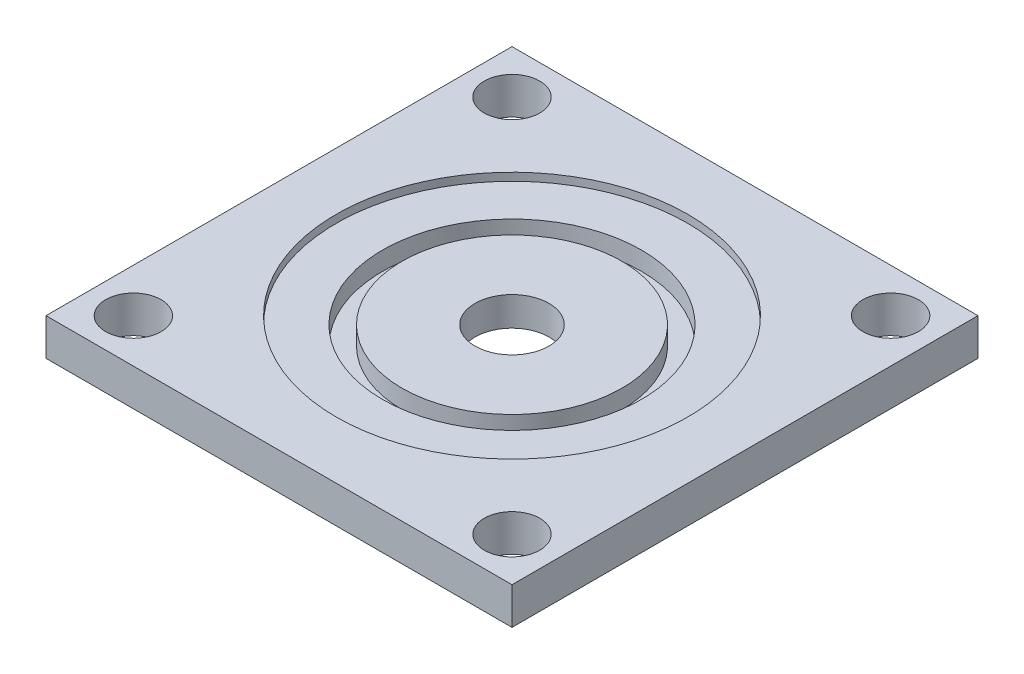
from build123d import *

# Parameters (mm, degrees)
PLATEOUTLINE_W      = 80
PLATEOUTLINE_H      = 80
BOSS_EXTRUDE1_DEPTH = 6.35
RAILGUIDES_R        = 4.7625
CUT_EXTRUDE1_DEPTH  = 10
CUT_EXTRUDE2_START  = 5
FUELGRAINMOUNTING_R = 30.1625
CUT_EXTRUDE2_DEPTH  = 5
GASINTAKE_R         = 6.35
CUT_EXTRUDE3_DEPTH  = 5
CUT_EXTRUDE4_START  = 5
SKETCH1_R           = 22.225
SKETCH1_R_2         = 18.878675
CUT_EXTRUDE4_DEPTH  = 3.175


with BuildPart() as part:
    # plateOutline → Boss-Extrude1 (new body)
    with BuildSketch(Plane(origin=(0, 0, 0), x_dir=(1, 0, 0), z_dir=(0, 1, 0))):
        Rectangle(PLATEOUTLINE_W, PLATEOUTLINE_H)
    extrude(amount=BOSS_EXTRUDE1_DEPTH)

    # railGuides → Cut-Extrude1 (cut)
    with BuildSketch(Plane(origin=(0, 0, 0), x_dir=(1, 0, 0), z_dir=(0, 1, 0))):
        with Locations((-32.5, 32.5)):
            Circle(RAILGUIDES_R)
        with Locations((32.5, 32.5)):
            Circle(RAILGUIDES_R)
        with Locations((32.5, -32.5)):
            Circle(RAILGUIDES_R)
        with Locations((-32.5, -32.5)):
            Circle(RAILGUIDES_R)
    extrude(amount=CUT_EXTRUDE1_DEPTH, mode=Mode.SUBTRACT)

    # FuelGrainMounting → Cut-Extrude2 (cut)
    with BuildSketch(Plane(origin=(0, 0, 0), x_dir=(1, 0, 0), z_dir=(0, 1, 0)).offset(CUT_EXTRUDE2_START)):
        Circle(FUELGRAINMOUNTING_R)
    extrude(amount=CUT_EXTRUDE2_DEPTH, mode=Mode.SUBTRACT)

    # GasIntake → Cut-Extrude3 (cut)
    with BuildSketch(Plane(origin=(0, 0, 0), x_dir=(1, 0, 0), z_dir=(0, 1, 0))):
        Circle(GASINTAKE_R)
    extrude(amount=CUT_EXTRUDE3_DEPTH, mode=Mode.SUBTRACT)

    # Sketch1 → Cut-Extrude4 (cut)
    with BuildSketch(Plane(origin=(0, 0, 0), x_dir=(1, 0, 0), z_dir=(0, 1, 0)).offset(CUT_EXTRUDE4_START)):
        Circle(SKETCH1_R)
        Circle(SKETCH1_R_2, mode=Mode.SUBTRACT)
    extrude(amount=-CUT_EXTRUDE4_DEPTH, mode=Mode.SUBTRACT)


solid = part.part
